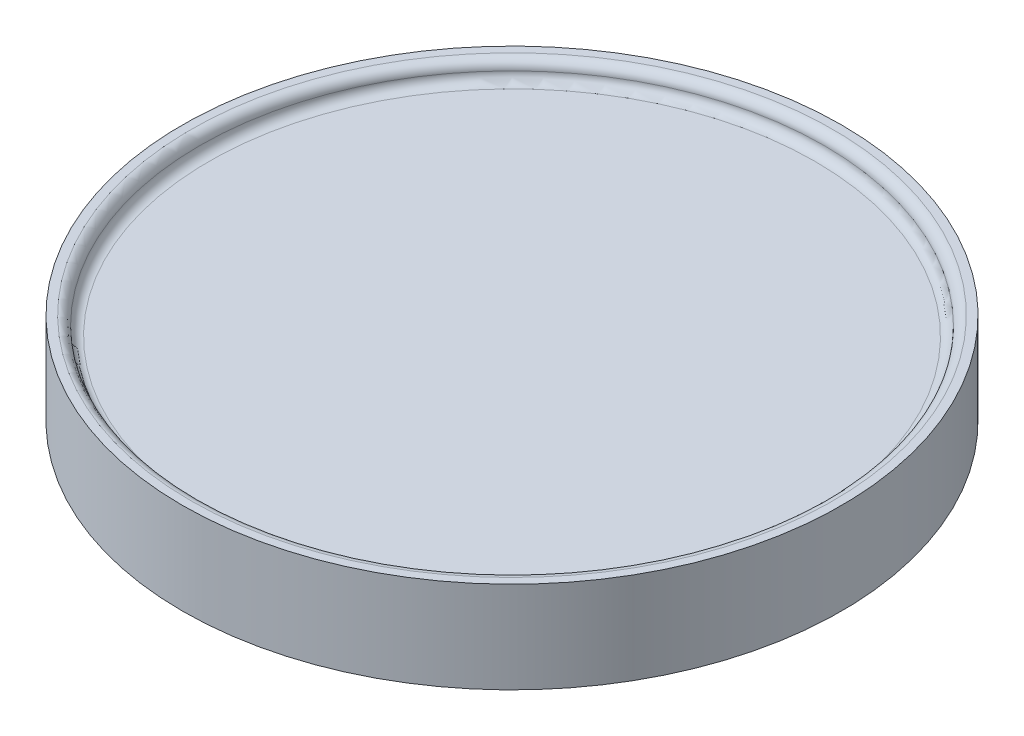
from build123d import *

# Parameters (mm, degrees)
SKETCH1_R           = 457.2
BOSS_EXTRUDE1_DEPTH = 127
SKETCH2_R           = 433.036421312
CUT_EXTRUDE2_DEPTH  = 25.4
FILLET3_R           = 12.7
FILLET4_R           = 12.7


with BuildPart() as part:
    # Sketch1 → Boss-Extrude1 (new body)
    with BuildSketch(Plane(origin=(0, 0, 0), x_dir=(1, 0, 0), z_dir=(0, 1, 0))):
        with Locations(Location((0, 0, 0), (0, 0, 270))):
            Circle(SKETCH1_R)
    extrude(amount=BOSS_EXTRUDE1_DEPTH)

    # Sketch2 → Cut-Extrude2 (cut)
    with BuildSketch(Plane(origin=(0, 127, 0), x_dir=(1, 0, 0), z_dir=(0, 1, 0))):
        with Locations(Location((0, 0, 0), (0, 0, 270))):
            Circle(SKETCH2_R)
    extrude(amount=-CUT_EXTRUDE2_DEPTH, mode=Mode.SUBTRACT)

    # Fillet3
    fillet3_edges = [part.edges().sort_by_distance(p)[0] for p in [
        (0, 127, -433.036421312),
    ]]
    fillet(fillet3_edges, radius=FILLET3_R)

    # Fillet4
    fillet4_edges = [part.edges().sort_by_distance(p)[0] for p in [
        (0, 101.6, -433.036421312),
    ]]
    fillet(fillet4_edges, radius=FILLET4_R - 0.0001)  # a hair under: the kernel refuses the full size


solid = part.part
